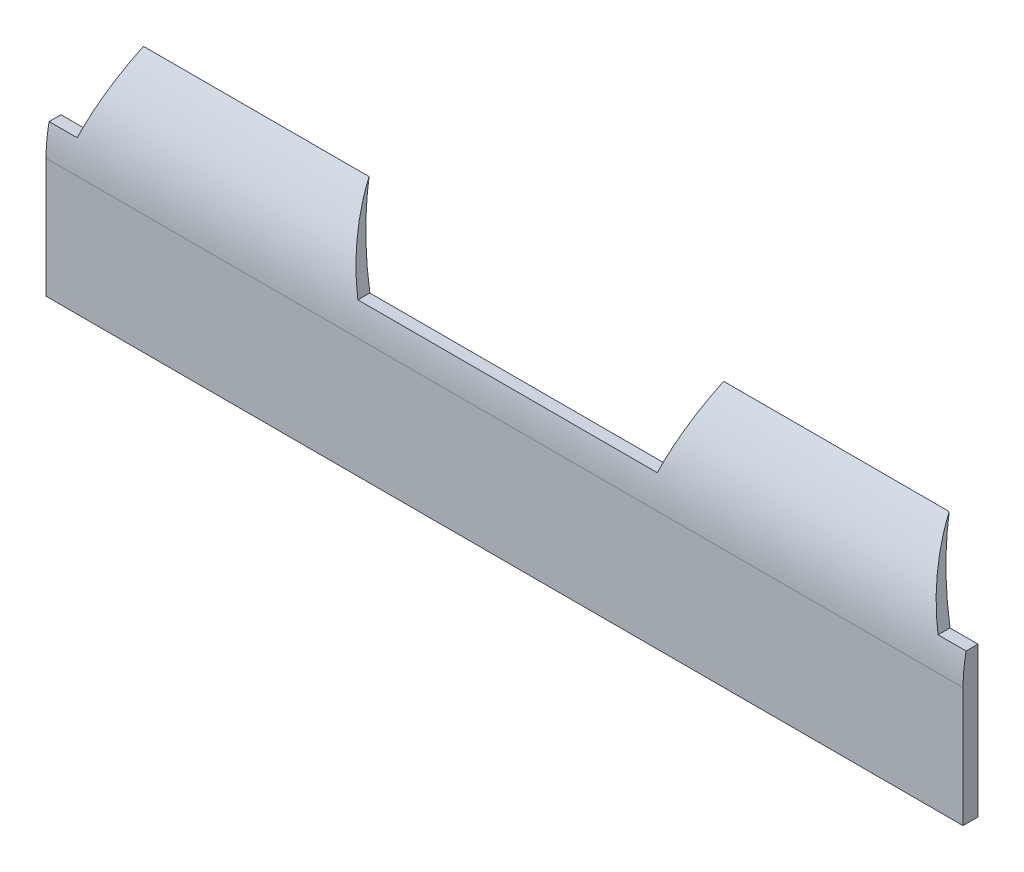
from build123d import *

# Parameters (mm, degrees)
P_IDAT_VYSUNUT_M2_DEPTH  = 0.8
P_IDAT_VYSUNUT_M3_DEPTH  = 1.5
ZAOBLIT1_R               = 8
ODEBRAT_VYSUNUT_M3_DEPTH = 51.416211215


with BuildPart() as part:
    # Skica1 → Přidat vysunutím2 (new body)
    with BuildSketch(Plane.XY):
        Polygon((24.5, -0.229513463), (-24.5, -0.229513463), (-24.5, 7.770486537), (-23, 7.770486537), (-21.499999864, 11.770486537), (-9.499999864, 11.770486537), (-8, 7.770487265), (8, 7.770487265), (9.499999864, 11.770486537), (21.499999864, 11.770486537), (23, 7.770486537), (24.5, 7.770486537), align=None)
    extrude(amount=P_IDAT_VYSUNUT_M2_DEPTH)

    # Skica2 → Přidat vysunutím3 (add)
    with BuildSketch(Plane(origin=(0, 0, 0), x_dir=(-1, 0, 0), z_dir=(0, 0, -1))):
        Polygon((-23, 7.770486537), (-21.499999864, 11.770486537), (-9.499999864, 11.770486537), (-8, 7.770487265), align=None)
        Polygon((8, 7.770487265), (23, 7.770486537), (21.499999864, 11.770486537), (9.499999864, 11.770486537), align=None)
    extrude(amount=P_IDAT_VYSUNUT_M3_DEPTH)

    # Zaoblit1
    # the kernel refuses this fillet: 8 mm, written as the material it takes off along each edge
    with BuildSketch(Plane(origin=(-4.533442337, 11.770486537, 0.8), x_dir=(0, -1, 0), z_dir=(1, 0, 0)), Plane(origin=(-35.533442064, 11.770486537, 0.8), x_dir=(0, -1, 0), z_dir=(1, 0, 0))) as zaoblit1_piece_1:
        with BuildLine():
            CenterArc((5.61337688, 8), ZAOBLIT1_R, 225.438687956, 44.561312044)
            Line((0, 2.3), (0, 0))
            Line((0, 0), (5.61337688, 0))
        make_face()
    extrude(amount=40.066884401, mode=Mode.SUBTRACT)

    # Skica7 → Odebrat vysunutím3 (cut, through all)
    with BuildSketch(Plane(origin=(24.5, 0, 0), x_dir=(0, 0, -1), z_dir=(1, 0, 0))):
        with BuildLine():
            Line((0, 7.739922094), (1.948215566, 7.739922094))
            Line((1.948215566, 7.739922094), (1.948215566, 12.51596757))
            add(Edge.make_bspline(
                [(0, 7.739922094), (0.473258475, 10.37513305), (1.948215566, 12.51596757)],
                knots=[0, 0, 0, 1, 1, 1], degree=2))
        make_face()
    extrude(amount=-ODEBRAT_VYSUNUT_M3_DEPTH, mode=Mode.SUBTRACT)


solid = part.part
